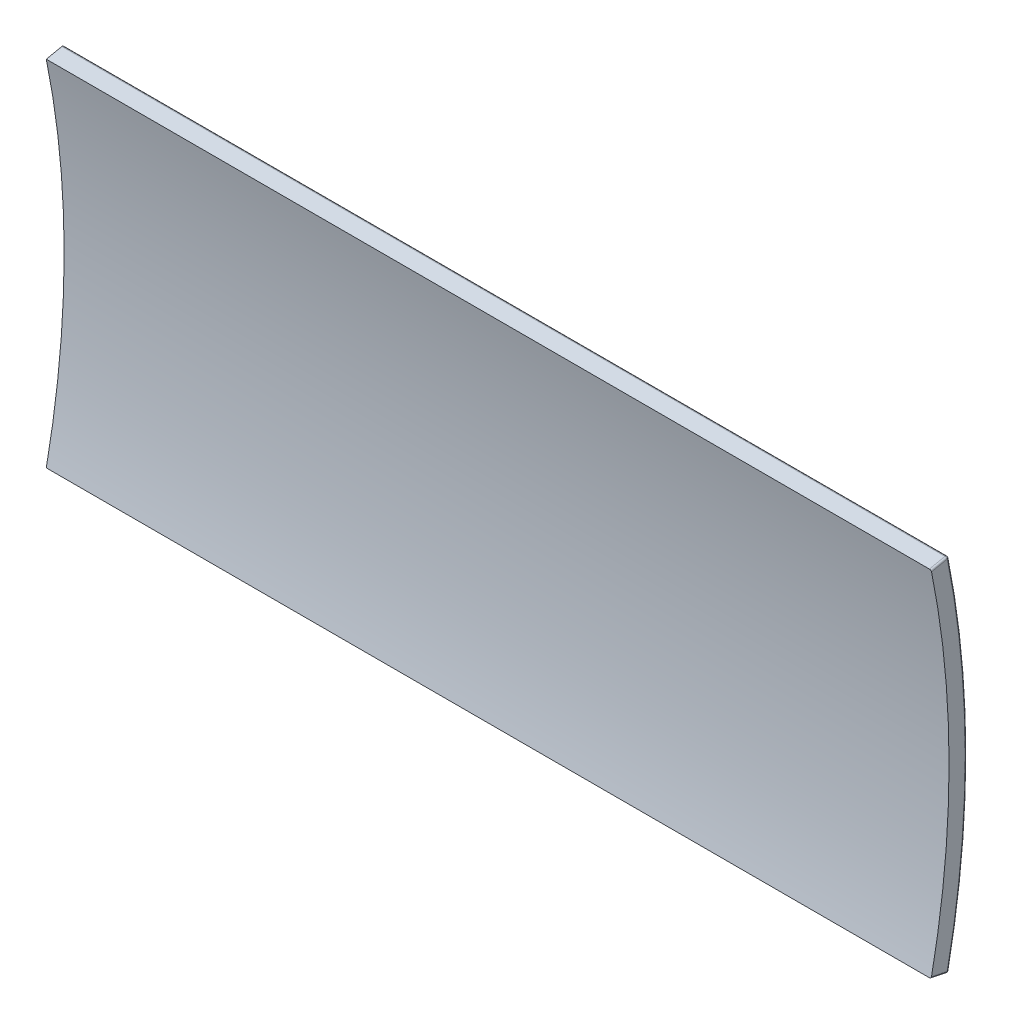
from build123d import *

# Parameters (mm, degrees)
BOSS_EXTRUDE1_DEPTH = 50
FILLET3_R           = 0.1


with BuildPart() as part:
    # airflap → Boss-Extrude1 (new body)
    with BuildSketch(Plane(origin=(0, 0, 0), x_dir=(0, 0, -1), z_dir=(1, 0, 0))):
        with BuildLine():
            Line((49.969590753, 10.2), (48.989794856, 10))
            ThreePointArc((48.989794856, 10), (50, 0), (48.989794856, -10))
            Line((48.989794856, -10), (49.969590753, -10.2))
            ThreePointArc((49.969590753, -10.2), (51, 0), (49.969590753, 10.2))
        make_face()
    extrude(amount=BOSS_EXTRUDE1_DEPTH)

    # Fillet3
    fillet3_edges = [part.edges().sort_by_distance(p)[0] for p in [
        (50, 10.1, -49.479692804),
        (50, -10.1, -49.479692804),
        (25, -10.2, -49.969590753),
        (25, 10.2, -49.969590753),
        (50, 0, -51),
    ]]
    fillet(fillet3_edges, radius=FILLET3_R)


solid = part.part
